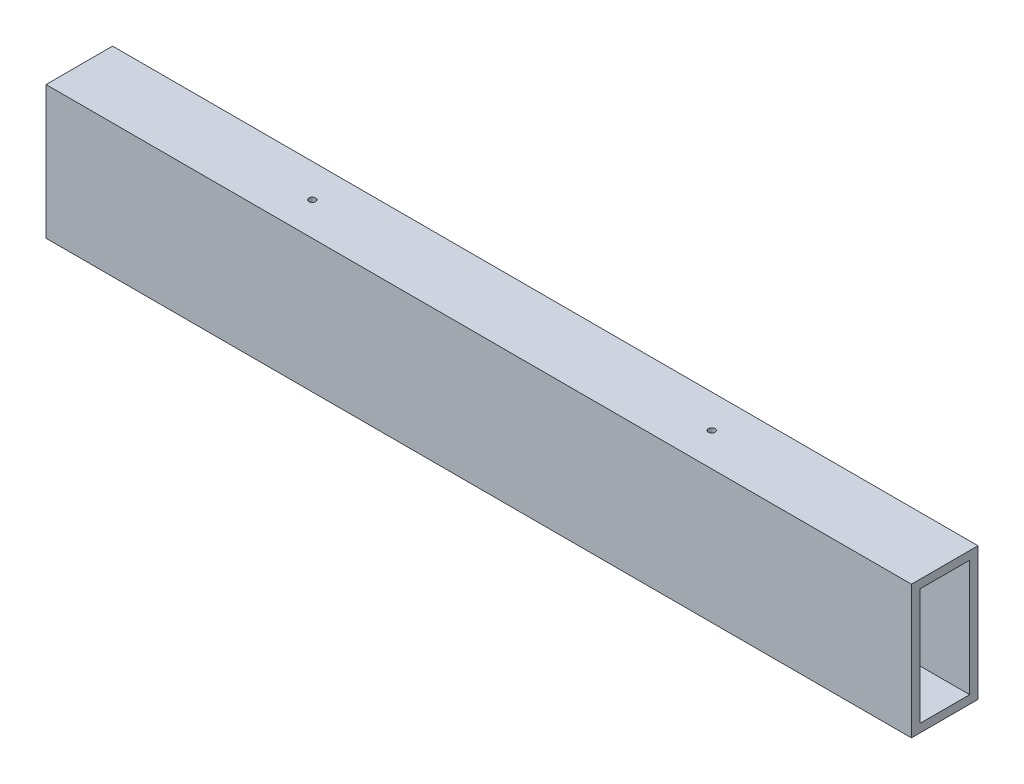
from build123d import *

# Parameters (mm, degrees)
SKETCH1_W             = 25.4
SKETCH1_H             = 50.8
SKETCH1_W_2           = 19.05
SKETCH1_H_2           = 44.45
BOSS_EXTRUDE1_DEPTH   = 330.2
M3X0_5_TAPPED_HOLE1_D = 2.5


with BuildPart() as part:
    # Sketch1 → Boss-Extrude1 (new body)
    with BuildSketch(Plane(origin=(0, 0, 0), x_dir=(0, 0, -1), z_dir=(1, 0, 0))):
        Rectangle(SKETCH1_W, SKETCH1_H)
        Rectangle(SKETCH1_W_2, SKETCH1_H_2, mode=Mode.SUBTRACT)
    extrude(amount=BOSS_EXTRUDE1_DEPTH)

    # M3x0.5 Tapped Hole1 (through all)
    with Locations(Plane(origin=(88.9, -25.4, 0), x_dir=(0, 0, -1), z_dir=(0, -1, 0))):
        with Locations((0, 0), (0, 152.4)):
            Hole(M3X0_5_TAPPED_HOLE1_D / 2)


solid = part.part
